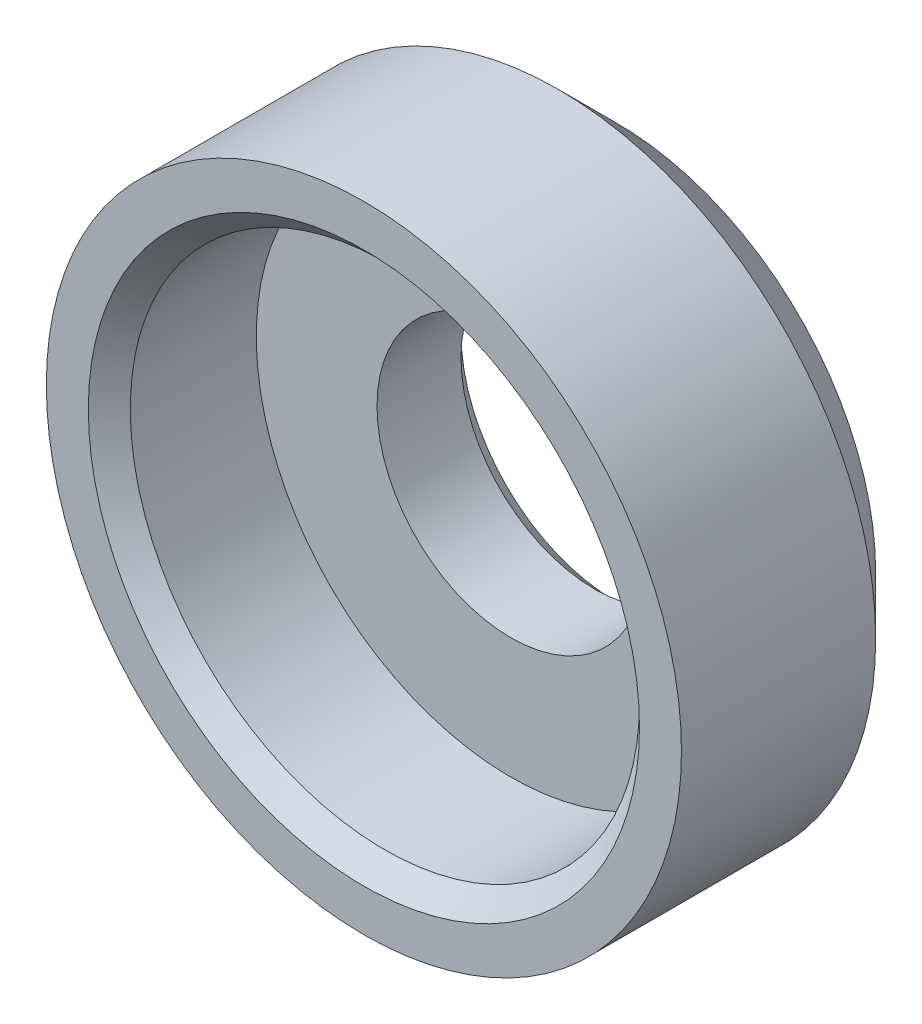
from build123d import *

# Parameters (mm, degrees)
ESQUISSE1_R        = 4.95
ESQUISSE1_R_2      = 2.55
BOSS_EXTRU_1_DEPTH = 2
ESQUISSE2_R        = 6.05
ESQUISSE2_R_2      = 4.85
BOSS_EXTRU_2_DEPTH = 2.8
CHANFREIN1_SIZE    = 2
CHANFREIN2_SIZE    = 0.4


with BuildPart() as part:
    # Esquisse1 → Boss.-Extru.1 (new body)
    with BuildSketch(Plane.XY):
        Circle(ESQUISSE1_R)
        Circle(ESQUISSE1_R_2, mode=Mode.SUBTRACT)
    extrude(amount=BOSS_EXTRU_1_DEPTH)

    # Esquisse2 → Boss.-Extru.2 (add)
    with BuildSketch(Plane.XY.offset(2)):
        Circle(ESQUISSE2_R)
        Circle(ESQUISSE2_R_2, mode=Mode.SUBTRACT)
    extrude(amount=BOSS_EXTRU_2_DEPTH)

    # Chanfrein1
    # the kernel refuses this chamfer: 2 mm, written as the material it adds along each edge
    with BuildSketch(Plane(origin=(0, 0, 2), x_dir=(1, 0, 0), z_dir=(0, -1, 0))) as chanfrein1_piece_1_section:
        Polygon((4.95, -CHANFREIN1_SIZE), (4.95 + CHANFREIN1_SIZE, 0), (4.95, 0), align=None)
    chanfrein1_piece_1 = revolve(axis=Axis((0, 0, 2), (0, 0, 1)), mode=Mode.PRIVATE)
    chanfrein1_piece_1 = split(chanfrein1_piece_1, bisect_by=Plane(origin=(-5.472506069, 0, 0), z_dir=(0, 0, 1)), keep=Keep.TOP, mode=Mode.PRIVATE)
    chanfrein1_piece_1 = chanfrein1_piece_1 & Plane(origin=(0, 0, 0.577493931), x_dir=(1, 0, 0), z_dir=(0, 0, -1)) * Cylinder(6.05, 28, mode=Mode.PRIVATE)
    add(chanfrein1_piece_1)

    # Chanfrein2
    chanfrein2_edges = [part.edges().sort_by_distance(p)[0] for p in [
        (-4.85, 0, 4.8),
        (-2.55, 0, 0),
    ]]
    chamfer(chanfrein2_edges, length=CHANFREIN2_SIZE)


solid = part.part
